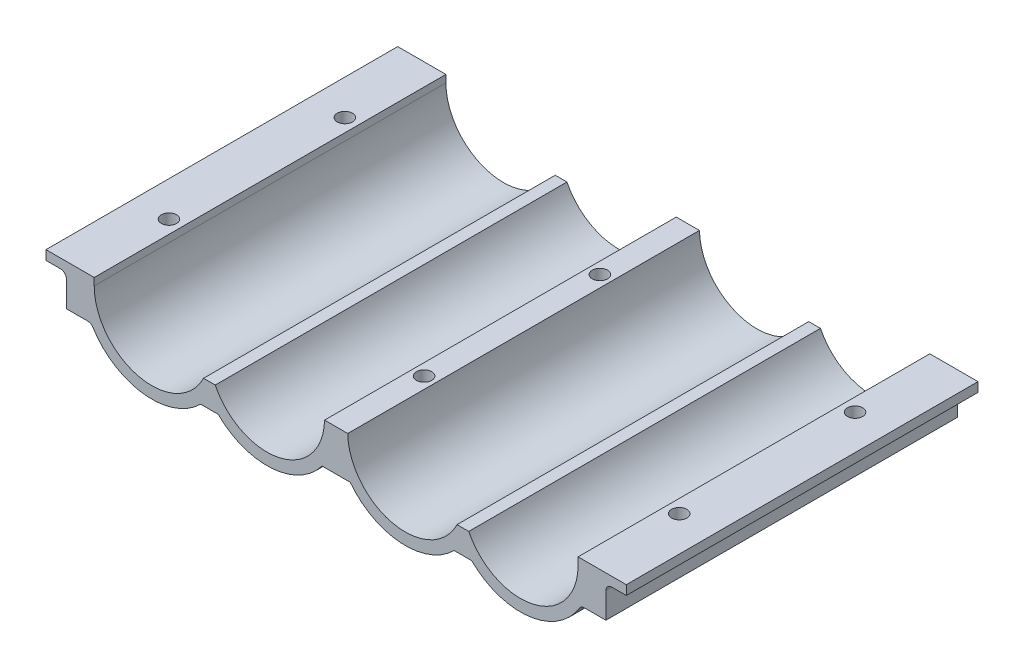
from build123d import *

# Parameters (mm, degrees)
BOSS_EXTRUDE1_DEPTH                  = 60
FILLET1_R                            = 1
F_2_6_START                          = -7
F_2_6_2_6_DIAMETER_HOLE1_OUTLINE_R   = 1.3
F_2_6_2_6_DIAMETER_HOLE1_DEPTH       = 7
F_2_6_START_2                        = -8.425
F_2_6_2_6_DIAMETER_HOLE1_2_OUTLINE_R = 1.3
F_2_6_2_6_DIAMETER_HOLE1_2_DEPTH     = 1.425


# Read off the part's stored shape, not the designer's step: Ø2.6 (2.6) Diameter Hole1
with BuildPart() as part:
    # Sketch1 → Boss-Extrude1 (new body)
    with BuildSketch(Plane.XY):
        with BuildLine():
            Line((0, 0), (8.225, 0))
            Line((8.225, 0), (8.225, -1.25))
            ThreePointArc((8.225, -1.25), (15.833583974, -10.821735736), (26.875, -5.568564576))
            Line((26.875, -5.568564576), (28.875, -5.568564576))
            ThreePointArc((28.875, -5.568564576), (39.831080274, -10.841095968), (47.523441352, -1.425))
            Line((47.523441352, -1.425), (51.476558648, -1.425))
            ThreePointArc((51.476558648, -1.425), (59.168919726, -10.841095968), (70.125, -5.568564576))
            Line((70.125, -5.568564576), (72.125, -5.568564576))
            ThreePointArc((72.125, -5.568564576), (83.166416026, -10.821735736), (90.775, -1.25))
            Line((90.775, -1.25), (90.775, 0))
            Line((90.775, 0), (99, 0))
            Line((99, 0), (99, -1.6))
            Line((99, -1.6), (95.52, -1.6))
            Line((95.52, -1.6), (95.52, -7))
            Line((95.52, -7), (91.282866253, -7))
            ThreePointArc((91.282866253, -7), (82.611549593, -12.957684568), (72.625, -9.647916408))
            Line((72.625, -9.647916408), (69.625, -9.647916408))
            ThreePointArc((69.625, -9.647916408), (60.486058022, -13.046953991), (51.90053193, -8.425))
            Line((51.90053193, -8.425), (47.09946807, -8.425))
            ThreePointArc((47.09946807, -8.425), (38.513941978, -13.046953991), (29.375, -9.647916408))
            Line((29.375, -9.647916408), (26.375, -9.647916408))
            ThreePointArc((26.375, -9.647916408), (16.388450407, -12.957684568), (7.717133747, -7))
            Line((7.717133747, -7), (3.48, -7))
            Line((3.48, -7), (3.48, -1.6))
            Line((3.48, -1.6), (0, -1.6))
            Line((0, -1.6), (0, 0))
        make_face()
    extrude(amount=BOSS_EXTRUDE1_DEPTH)

    # Fillet1
    fillet1_edges = [part.edges().sort_by_distance(p)[0] for p in [
        (95.52, -1.6, 30),
        (91.282866253, -7, 30),
        (7.717133747, -7, 30),
        (3.48, -1.6, 30),
    ]]
    fillet(fillet1_edges, radius=FILLET1_R)

    # Ø2.6 (2.6) Diameter Hole1 outline → Ø2.6 (2.6) Diameter Hole1 (cut)
    with BuildSketch(Plane(origin=(0, 0, 0), x_dir=(1, 0, 0), z_dir=(0, 1, 0)).offset(F_2_6_START)):
        with Locations((93.02, -15)):
            Circle(F_2_6_2_6_DIAMETER_HOLE1_OUTLINE_R)
        with Locations((93.02, -45)):
            Circle(F_2_6_2_6_DIAMETER_HOLE1_OUTLINE_R)
        with Locations((49.5, -15)):
            Circle(F_2_6_2_6_DIAMETER_HOLE1_OUTLINE_R)
        with Locations((49.5, -45)):
            Circle(F_2_6_2_6_DIAMETER_HOLE1_OUTLINE_R)
    f_2_6_2_6_diameter_hole1 = extrude(amount=F_2_6_2_6_DIAMETER_HOLE1_DEPTH, mode=Mode.SUBTRACT)

    # 2.6 _2.6_ Diameter Hole1 2 outline → 2.6 _2.6_ Diameter Hole1 2 (cut)
    with BuildSketch(Plane(origin=(0, 0, 0), x_dir=(1, 0, 0), z_dir=(0, 1, 0)).offset(F_2_6_START_2)):
        with Locations((49.5, -15)):
            Circle(F_2_6_2_6_DIAMETER_HOLE1_2_OUTLINE_R)
        with Locations((49.5, -45)):
            Circle(F_2_6_2_6_DIAMETER_HOLE1_2_OUTLINE_R)
    f_2_6_2_6_diameter_hole1_2 = extrude(amount=F_2_6_2_6_DIAMETER_HOLE1_2_DEPTH, mode=Mode.SUBTRACT)

    # Mirror1: Ø2.6 (2.6) Diameter Hole1, 2.6 _2.6_ Diameter Hole1 2 across plane
    add(f_2_6_2_6_diameter_hole1.mirror(Plane.ZY.offset(-49.5)), mode=Mode.SUBTRACT)
    add(f_2_6_2_6_diameter_hole1_2.mirror(Plane.ZY.offset(-49.5)), mode=Mode.SUBTRACT)


solid = part.part
